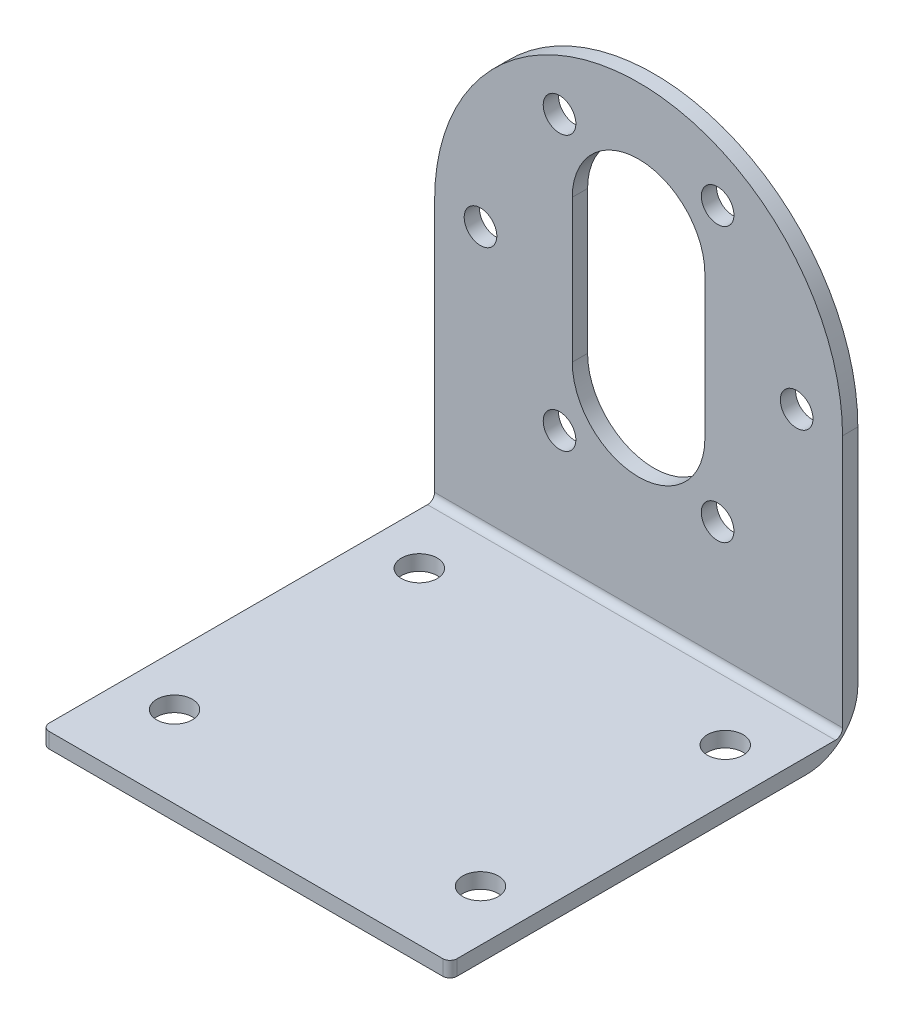
from build123d import *

# Parameters (mm, degrees)
MAINPIECE_DEPTH       = 40
CHASSISHOLES_REACH    = 75.546
SKETCH2_R             = 1.75
DOME_REACH            = 75.546
WHEELMOTORGUIDE_REACH = 75.546
SKETCH4_R             = 1.6
FILLET1_R             = 0.7


with BuildPart() as part:
    # Sketch1 → MainPiece (new body)
    with BuildSketch(Plane(origin=(0, 0, 0), x_dir=(0, 0, -1), z_dir=(1, 0, 0))):
        with BuildLine():
            Line((0, 1.5), (0, 0))
            Line((0, 0), (34.963274192, 0))
            ThreePointArc((34.963274192, 0), (38.524777166, 1.475222834), (40, 5.036725808))
            Line((40, 5.036725808), (40, 47))
            Line((40, 47), (38.5, 47))
            Line((38.5, 47), (38.5, 1.5))
            Line((38.5, 1.5), (0, 1.5))
        make_face()
    extrude(amount=MAINPIECE_DEPTH)

    # Sketch2 → ChassisHoles (cut, up to next)
    with BuildSketch(Plane(origin=(0, 0, 0), x_dir=(-1, 0, 0), z_dir=(0, -1, 0)), mode=Mode.PRIVATE) as chassisholes_sk1:
        with Locations((-5, 8)):
            Circle(SKETCH2_R)
    chassisholes_tool1 = extrude(chassisholes_sk1.sketch, amount=-CHASSISHOLES_REACH, mode=Mode.PRIVATE) & part.part
    # Sketch2 → ChassisHoles (cut, up to next)
    with BuildSketch(Plane(origin=(0, 0, 0), x_dir=(-1, 0, 0), z_dir=(0, -1, 0)), mode=Mode.PRIVATE) as chassisholes_sk2:
        with Locations((-35, 8)):
            Circle(SKETCH2_R)
    chassisholes_tool2 = extrude(chassisholes_sk2.sketch, amount=-CHASSISHOLES_REACH, mode=Mode.PRIVATE) & part.part
    # Sketch2 → ChassisHoles (cut, up to next)
    with BuildSketch(Plane(origin=(0, 0, 0), x_dir=(-1, 0, 0), z_dir=(0, -1, 0)), mode=Mode.PRIVATE) as chassisholes_sk3:
        with Locations((-35, 32)):
            Circle(SKETCH2_R)
    chassisholes_tool3 = extrude(chassisholes_sk3.sketch, amount=-CHASSISHOLES_REACH, mode=Mode.PRIVATE) & part.part
    # Sketch2 → ChassisHoles (cut, up to next)
    with BuildSketch(Plane(origin=(0, 0, 0), x_dir=(-1, 0, 0), z_dir=(0, -1, 0)), mode=Mode.PRIVATE) as chassisholes_sk4:
        with Locations((-5, 32)):
            Circle(SKETCH2_R)
    chassisholes_tool4 = extrude(chassisholes_sk4.sketch, amount=-CHASSISHOLES_REACH, mode=Mode.PRIVATE) & part.part
    add(chassisholes_tool1.solids().sort_by_distance((5, 0, -8))[0], mode=Mode.SUBTRACT)
    add(chassisholes_tool2.solids().sort_by_distance((35, 0, -8))[0], mode=Mode.SUBTRACT)
    add(chassisholes_tool3.solids().sort_by_distance((35, 0, -32))[0], mode=Mode.SUBTRACT)
    add(chassisholes_tool4.solids().sort_by_distance((5, 0, -32))[0], mode=Mode.SUBTRACT)

    # Sketch3 → Dome (cut, up to next)
    with BuildSketch(Plane(origin=(0, 0, -40), x_dir=(-1, 0, 0), z_dir=(0, 0, -1)), mode=Mode.PRIVATE) as dome_sk1:
        with BuildLine():
            Line((0, 47), (-20, 47))
            ThreePointArc((-20, 47), (-5.857864376, 41.142135624), (0, 27))
            Line((0, 27), (0, 47))
        make_face()
    dome_tool1 = extrude(dome_sk1.sketch, amount=-DOME_REACH, mode=Mode.PRIVATE) & part.part
    # Sketch3 → Dome (cut, up to next)
    with BuildSketch(Plane(origin=(0, 0, -40), x_dir=(-1, 0, 0), z_dir=(0, 0, -1)), mode=Mode.PRIVATE) as dome_sk2:
        with BuildLine():
            Line((-40, 47), (-40, 27))
            ThreePointArc((-40, 27), (-34.142135624, 41.142135624), (-20, 47))
            Line((-20, 47), (-40, 47))
        make_face()
    dome_tool2 = extrude(dome_sk2.sketch, amount=-DOME_REACH, mode=Mode.PRIVATE) & part.part
    add(dome_tool1.solids().sort_by_distance((4.467359, 42.532641, -40))[0], mode=Mode.SUBTRACT)
    add(dome_tool2.solids().sort_by_distance((35.532641, 42.532641, -40))[0], mode=Mode.SUBTRACT)

    # Sketch4 → WheelMotorGuide (cut, up to next)
    with BuildSketch(Plane(origin=(0, 0, -40), x_dir=(-1, 0, 0), z_dir=(0, 0, -1)), mode=Mode.PRIVATE) as wheelmotorguide_sk1:
        with Locations((-35.500160217, 27)):
            Circle(SKETCH4_R)
    wheelmotorguide_tool1 = extrude(wheelmotorguide_sk1.sketch, amount=-WHEELMOTORGUIDE_REACH, mode=Mode.PRIVATE) & part.part
    # Sketch4 → WheelMotorGuide (cut, up to next)
    with BuildSketch(Plane(origin=(0, 0, -40), x_dir=(-1, 0, 0), z_dir=(0, 0, -1)), mode=Mode.PRIVATE) as wheelmotorguide_sk2:
        with Locations((-27.750080108, 40.42353251)):
            Circle(SKETCH4_R)
    wheelmotorguide_tool2 = extrude(wheelmotorguide_sk2.sketch, amount=-WHEELMOTORGUIDE_REACH, mode=Mode.PRIVATE) & part.part
    # Sketch4 → WheelMotorGuide (cut, up to next)
    with BuildSketch(Plane(origin=(0, 0, -40), x_dir=(-1, 0, 0), z_dir=(0, 0, -1)), mode=Mode.PRIVATE) as wheelmotorguide_sk3:
        with Locations((-12.249919892, 40.42353251)):
            Circle(SKETCH4_R)
    wheelmotorguide_tool3 = extrude(wheelmotorguide_sk3.sketch, amount=-WHEELMOTORGUIDE_REACH, mode=Mode.PRIVATE) & part.part
    # Sketch4 → WheelMotorGuide (cut, up to next)
    with BuildSketch(Plane(origin=(0, 0, -40), x_dir=(-1, 0, 0), z_dir=(0, 0, -1)), mode=Mode.PRIVATE) as wheelmotorguide_sk4:
        with Locations((-4.499839783, 27)):
            Circle(SKETCH4_R)
    wheelmotorguide_tool4 = extrude(wheelmotorguide_sk4.sketch, amount=-WHEELMOTORGUIDE_REACH, mode=Mode.PRIVATE) & part.part
    # Sketch4 → WheelMotorGuide (cut, up to next)
    with BuildSketch(Plane(origin=(0, 0, -40), x_dir=(-1, 0, 0), z_dir=(0, 0, -1)), mode=Mode.PRIVATE) as wheelmotorguide_sk5:
        with Locations((-12.249919892, 13.57646749)):
            Circle(SKETCH4_R)
    wheelmotorguide_tool5 = extrude(wheelmotorguide_sk5.sketch, amount=-WHEELMOTORGUIDE_REACH, mode=Mode.PRIVATE) & part.part
    # Sketch4 → WheelMotorGuide (cut, up to next)
    with BuildSketch(Plane(origin=(0, 0, -40), x_dir=(-1, 0, 0), z_dir=(0, 0, -1)), mode=Mode.PRIVATE) as wheelmotorguide_sk6:
        with Locations((-27.750080108, 13.57646749)):
            Circle(SKETCH4_R)
    wheelmotorguide_tool6 = extrude(wheelmotorguide_sk6.sketch, amount=-WHEELMOTORGUIDE_REACH, mode=Mode.PRIVATE) & part.part
    # Sketch4 → WheelMotorGuide (cut, up to next)
    with BuildSketch(Plane(origin=(0, 0, -40), x_dir=(-1, 0, 0), z_dir=(0, 0, -1)), mode=Mode.PRIVATE) as wheelmotorguide_sk7:
        with BuildLine():
            Line((-26.5, 20), (-26.5, 34))
            ThreePointArc((-26.5, 34), (-20, 40.5), (-13.5, 34))
            Line((-13.5, 34), (-13.5, 20))
            ThreePointArc((-13.5, 20), (-20, 13.5), (-26.5, 20))
        make_face()
    wheelmotorguide_tool7 = extrude(wheelmotorguide_sk7.sketch, amount=-WHEELMOTORGUIDE_REACH, mode=Mode.PRIVATE) & part.part
    add(wheelmotorguide_tool1.solids().sort_by_distance((35.50016, 27, -40))[0], mode=Mode.SUBTRACT)
    add(wheelmotorguide_tool2.solids().sort_by_distance((27.75008, 40.423533, -40))[0], mode=Mode.SUBTRACT)
    add(wheelmotorguide_tool3.solids().sort_by_distance((12.24992, 40.423533, -40))[0], mode=Mode.SUBTRACT)
    add(wheelmotorguide_tool4.solids().sort_by_distance((4.49984, 27, -40))[0], mode=Mode.SUBTRACT)
    add(wheelmotorguide_tool5.solids().sort_by_distance((12.24992, 13.576467, -40))[0], mode=Mode.SUBTRACT)
    add(wheelmotorguide_tool6.solids().sort_by_distance((27.75008, 13.576467, -40))[0], mode=Mode.SUBTRACT)
    add(wheelmotorguide_tool7.solids().sort_by_distance((20, 27, -40))[0], mode=Mode.SUBTRACT)

    # Fillet1
    fillet1_edges = [part.edges().sort_by_distance(p)[0] for p in [
        (0, 0.75, 0),
        (40, 0.75, 0),
        (20, 1.5, -38.5),
    ]]
    fillet(fillet1_edges, radius=FILLET1_R)


solid = part.part
